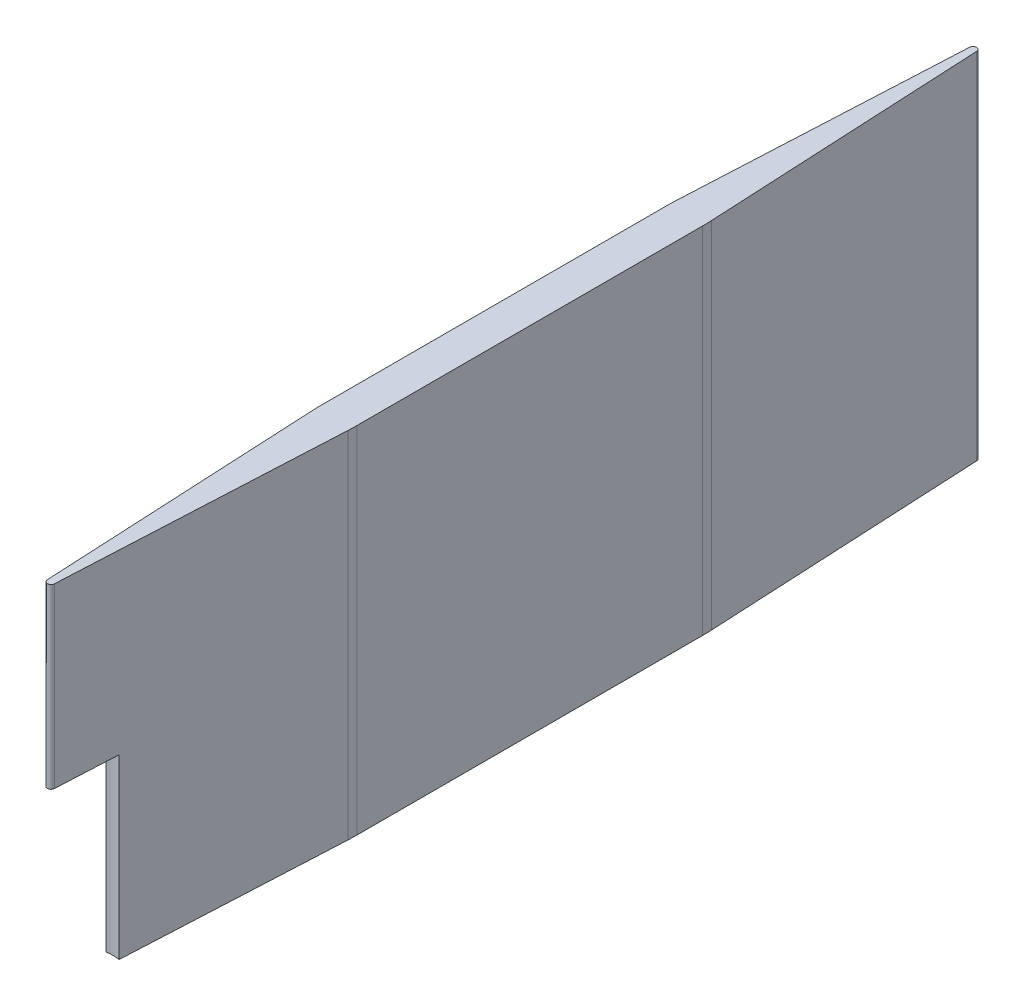
from build123d import *

# Parameters (mm, degrees)
BOSS_EXTRUDE1_DEPTH = 25.4
FILLET1_R           = 12.7
SKETCH4_R           = 3.175
CUT_EXTRUDE2_DEPTH  = 12.7


with BuildPart() as part:
    # Sketch1 → Boss-Extrude1 (new body)
    with BuildSketch(Plane(origin=(0, 0, 0), x_dir=(1, 0, 0), z_dir=(0, 1, 0))):
        with BuildLine():
            Line((-1.27, 50.8), (-1.27, 25.4))
            Line((-1.27, 25.4), (-0.253683094, 5.073661881))
            ThreePointArc((-0.253683094, 5.073661881), (0, 4.832346036), (0.253683094, 5.073661881))
            Line((0.253683094, 5.073661881), (1.27, 25.4))
            Line((1.27, 25.4), (1.27, 50.8))
            Line((1.27, 50.8), (0.253683094, 71.126338119))
            ThreePointArc((0.253683094, 71.126338119), (0, 71.367653964), (-0.253683094, 71.126338119))
            Line((-0.253683094, 71.126338119), (-1.27, 50.8))
        make_face()
    extrude(amount=BOSS_EXTRUDE1_DEPTH)

    # Fillet1
    # the kernel refuses this fillet: 12.7 mm, written as the material it takes off along each edge
    with BuildSketch(Plane(origin=(-1.27, -0.793254525, -25.4), x_dir=(0, 0, -1), z_dir=(0, 1, 0)), Plane(origin=(-1.27, -0.793254525, -50.8), x_dir=(0.04993761694389363, 0, -0.9987523388778445), z_dir=(0, 1, 0)), Plane(origin=(1.27, -0.793254525, -50.8), x_dir=(0, 0, 1), z_dir=(0, 1, 0)), Plane(origin=(1.27, -0.793254525, -25.4), x_dir=(-0.04993761694389503, 0, 0.9987523388778445), z_dir=(0, 1, 0))) as fillet1_piece_1:
        with BuildLine():
            CenterArc((FILLET1_R * 0.0249843945008, -FILLET1_R), FILLET1_R, 90, 2.862405226)
            Line((-FILLET1_R * 0.0249532224431, -FILLET1_R * 0.00124766112216), (0, 0))
            Line((0, 0), (FILLET1_R * 0.0249843945008, 0))
        make_face()
    extrude(amount=26.986509051, mode=Mode.SUBTRACT)

    # Sketch4 → Cut-Extrude2 (cut)
    with BuildSketch(Plane(origin=(0, 0, 0), x_dir=(1, 0, 0), z_dir=(0, 1, 0))):
        with Locations((0, 6.35)):
            Circle(SKETCH4_R)
    extrude(amount=CUT_EXTRUDE2_DEPTH, mode=Mode.SUBTRACT)


solid = part.part
